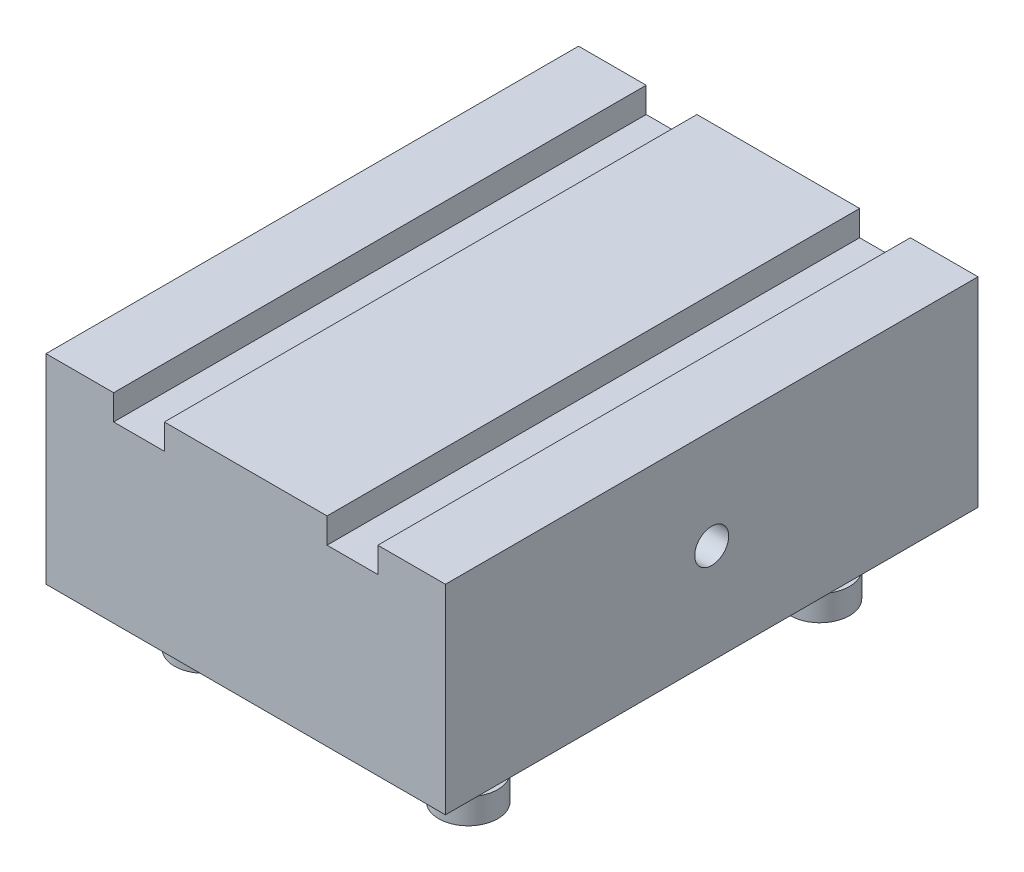
from build123d import *

# Parameters (mm, degrees)
SKETCH1_W               = 59.999999888
SKETCH1_H               = 80
BOSS_EXTRUDE1_DEPTH     = 30
SKETCH2_W               = 7.62
SKETCH2_H               = 3.81
CUT_EXTRUDE1_DEPTH      = 105.403065025
SKETCH3_R               = 4.445
BOSS_EXTRUDE2_DEPTH     = 3.81
SKETCH4_R               = 2.54
BOSS_EXTRUDE3_DEPTH     = 2.54
SKETCH5_R               = 4.445
BOSS_EXTRUDE4_DEPTH     = 3.81
F_1_4_20_TAPPED_HOLE1_D = 5.1054


with BuildPart() as part:
    # Sketch1 → Boss-Extrude1 (new body)
    with BuildSketch(Plane(origin=(0, 0, 0), x_dir=(1, 0, 0), z_dir=(0, 1, 0))):
        with Locations((29.999999944, 40)):
            Rectangle(SKETCH1_W, SKETCH1_H)
    extrude(amount=-BOSS_EXTRUDE1_DEPTH)

    # Sketch2 → Cut-Extrude1 (cut, through all)
    with BuildSketch(Plane.XY):
        with Locations((13.97, -1.905)):
            Rectangle(SKETCH2_W, SKETCH2_H)
        with Locations((46.029999888, -1.905)):
            Rectangle(SKETCH2_W, SKETCH2_H)
    extrude(amount=-CUT_EXTRUDE1_DEPTH, mode=Mode.SUBTRACT)

    # Sketch3 → Boss-Extrude2 (add)
    with BuildSketch(Plane.XZ.offset(30)):
        with Locations((49.839999888, -13.584)):
            Circle(SKETCH3_R)
        with Locations((10.16, -13.584)):
            Circle(SKETCH3_R)
        with Locations((49.839999888, -66.416)):
            Circle(SKETCH3_R)
        with Locations((10.16, -66.416)):
            Circle(SKETCH3_R)
    extrude(amount=BOSS_EXTRUDE2_DEPTH)

    # Sketch4 → Boss-Extrude3 (add)
    with BuildSketch(Plane.XZ.offset(33.81)):
        with Locations((49.839999888, -13.584)):
            Circle(SKETCH4_R)
        with Locations((10.16, -13.584)):
            Circle(SKETCH4_R)
        with Locations((10.16, -66.416)):
            Circle(SKETCH4_R)
        with Locations((49.839999888, -66.416)):
            Circle(SKETCH4_R)
    extrude(amount=BOSS_EXTRUDE3_DEPTH)

    # Sketch5 → Boss-Extrude4 (add)
    with BuildSketch(Plane.XZ.offset(36.35)):
        with Locations((10.16, -13.584)):
            Circle(SKETCH5_R)
        with Locations((10.16, -66.416)):
            Circle(SKETCH5_R)
        with Locations((49.839999888, -66.416)):
            Circle(SKETCH5_R)
        with Locations((49.839999888, -13.584)):
            Circle(SKETCH5_R)
    extrude(amount=BOSS_EXTRUDE4_DEPTH)

    # 1/4-20 Tapped Hole1 (through all)
    with Locations(Plane(origin=(59.999999888, 0, 0), x_dir=(0, 0, -1), z_dir=(1, 0, 0))):
        with Locations((40, -15)):
            Hole(F_1_4_20_TAPPED_HOLE1_D / 2)


solid = part.part
